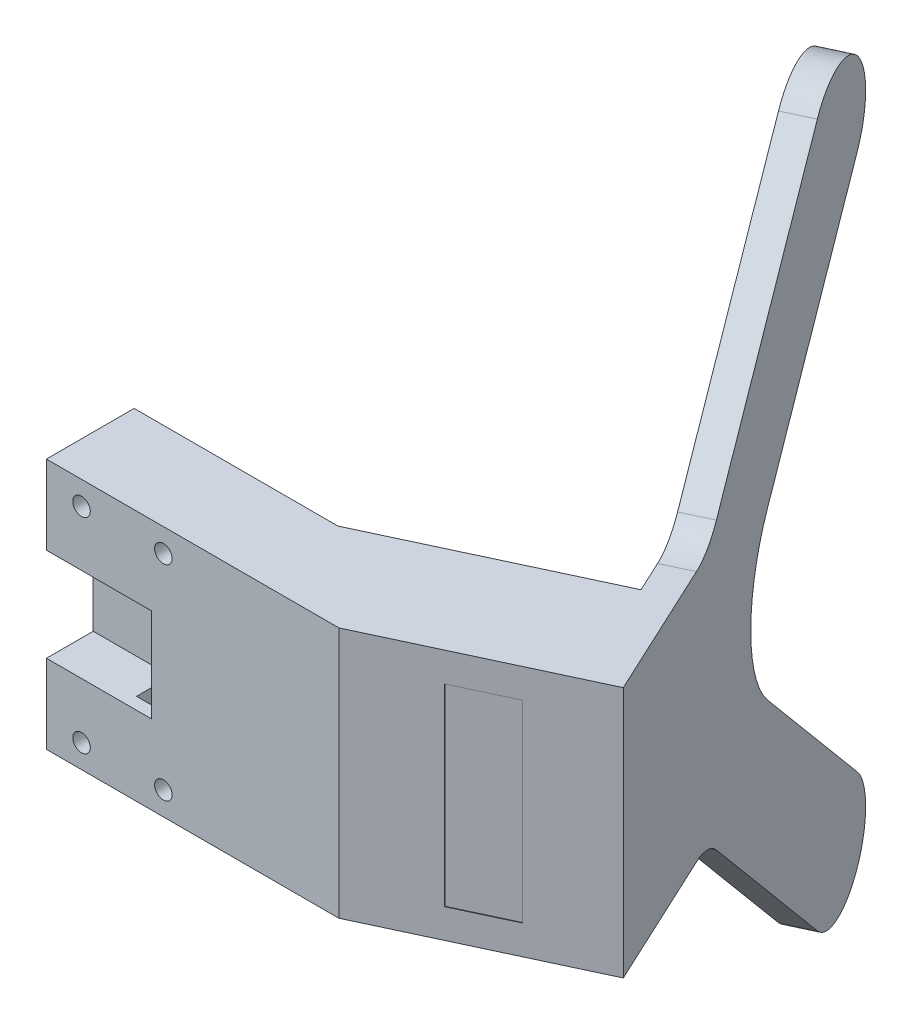
from build123d import *

# Parameters (mm, degrees)
AUFSATZ_LINEAR_AUSTRAGEN1_DEPTH      = 43
AUFSATZ_LINEAR_AUSTRAGEN2_DEPTH      = 5
SCHNITT_LINEAR_AUSTRAGEN1_REACH      = 157.451
SKIZZE3_R                            = 1.5
SKIZZE4_W                            = 8
SKIZZE4_H                            = 16
SCHNITT_LINEAR_AUSTRAGEN2_DEPTH      = 18
SKIZZE5_W                            = 30
SKIZZE5_H                            = 39
SCHNITT_LINEAR_AUSTRAGEN3_DEPTH      = 18
SKIZZE6_W                            = 7
SKIZZE6_H                            = 7.5
SKIZZE6_H_2                          = 14
SKIZZE6_H_3                          = 5.5
AUFSATZ_LINEAR_AUSTRAGEN3_DEPTH      = 4
VERRUNDUNG1_R                        = 2
F_3_4_3_4_DURCHMESSER_BOHRUNG1_D     = 3.4
F_3_4_3_4_DURCHMESSER_BOHRUNG1_DEPTH = 4
SKIZZE10_W                           = 10
SKIZZE10_H                           = 33
SCHNITT_LINEAR_AUSTRAGEN4_DEPTH      = 1
SKIZZE11_W                           = 10
SKIZZE11_H                           = 33
SCHNITT_LINEAR_AUSTRAGEN5_DEPTH      = 0.1
SCHNITT_LINEAR_AUSTRAGEN7_DEPTH      = 39
SKIZZE15_W                           = 10.432594073
SKIZZE15_H                           = 24
SCHNITT_LINEAR_AUSTRAGEN10_DEPTH     = 16
SKIZZE16_W                           = 2.1
SKIZZE16_H                           = 39
SCHNITT_LINEAR_AUSTRAGEN11_DEPTH     = 2
VERRUNDUNG2_R                        = 20
VERRUNDUNG3_R                        = 10
SKIZZE17_W                           = 6
SKIZZE17_H                           = 6
AUFSATZ_LINEAR_AUSTRAGEN4_DEPTH      = 5
FASE1_SIZE                           = 6
F_3_4_3_4_DURCHMESSER_BOHRUNG2_D     = 3.4
F_3_4_3_4_DURCHMESSER_BOHRUNG2_DEPTH = 5
F_3_4_3_4_DURCHMESSER_BOHRUNG2_TIP   = 1.021463052


with BuildPart() as part:
    # Skizze1 → Aufsatz-Linear austragen1 (new body)
    with BuildSketch(Plane(origin=(0, 0, 0), x_dir=(1, 0, 0), z_dir=(0, 1, 0))):
        Polygon((0, 0), (50, 0), (78.641941074, 13.355956467), (70.189575839, 31.482112208), (34.843572145, 15), (0, 15), align=None)
    extrude(amount=AUFSATZ_LINEAR_AUSTRAGEN1_DEPTH)

    # Skizze2 → Aufsatz-Linear austragen2 (add)
    with BuildSketch(Plane(origin=(69.711631316, 0, -32.507067545), x_dir=(-0.4226182617407004, 0, -0.9063077870366495), z_dir=(0.9063077870366495, 0, -0.4226182617407004))):
        Polygon((-21.130913087, 43), (8.869086913, 43), (54.544231126, 88.675144213), (68.686366749, 74.533008589), (15.65335816, 21.5), (68.686366749, -31.533008589), (54.544231126, -45.675144213), (8.869086913, 0), (-21.130913087, 0), align=None)
    extrude(amount=AUFSATZ_LINEAR_AUSTRAGEN2_DEPTH)

    # Skizze3 → Schnitt-Linear austragen1 (cut, up to next)
    with BuildSketch(Plane.XY, mode=Mode.PRIVATE) as schnitt_linear_austragen1_sk1:
        with Locations((6, 39)):
            Circle(SKIZZE3_R)
    schnitt_linear_austragen1_tool1 = extrude(schnitt_linear_austragen1_sk1.sketch, amount=-SCHNITT_LINEAR_AUSTRAGEN1_REACH, mode=Mode.PRIVATE) & part.part
    # Skizze3 → Schnitt-Linear austragen1 (cut, up to next)
    with BuildSketch(Plane.XY, mode=Mode.PRIVATE) as schnitt_linear_austragen1_sk2:
        with Locations((20, 39)):
            Circle(SKIZZE3_R)
    schnitt_linear_austragen1_tool2 = extrude(schnitt_linear_austragen1_sk2.sketch, amount=-SCHNITT_LINEAR_AUSTRAGEN1_REACH, mode=Mode.PRIVATE) & part.part
    # Skizze3 → Schnitt-Linear austragen1 (cut, up to next)
    with BuildSketch(Plane.XY, mode=Mode.PRIVATE) as schnitt_linear_austragen1_sk3:
        with Locations((6, 4)):
            Circle(SKIZZE3_R)
    schnitt_linear_austragen1_tool3 = extrude(schnitt_linear_austragen1_sk3.sketch, amount=-SCHNITT_LINEAR_AUSTRAGEN1_REACH, mode=Mode.PRIVATE) & part.part
    # Skizze3 → Schnitt-Linear austragen1 (cut, up to next)
    with BuildSketch(Plane.XY, mode=Mode.PRIVATE) as schnitt_linear_austragen1_sk4:
        with Locations((20, 4)):
            Circle(SKIZZE3_R)
    schnitt_linear_austragen1_tool4 = extrude(schnitt_linear_austragen1_sk4.sketch, amount=-SCHNITT_LINEAR_AUSTRAGEN1_REACH, mode=Mode.PRIVATE) & part.part
    add(schnitt_linear_austragen1_tool1.solids().sort_by_distance((6, 39, 0))[0], mode=Mode.SUBTRACT)
    add(schnitt_linear_austragen1_tool2.solids().sort_by_distance((20, 39, 0))[0], mode=Mode.SUBTRACT)
    add(schnitt_linear_austragen1_tool3.solids().sort_by_distance((6, 4, 0))[0], mode=Mode.SUBTRACT)
    add(schnitt_linear_austragen1_tool4.solids().sort_by_distance((20, 4, 0))[0], mode=Mode.SUBTRACT)

    # Skizze4 → Schnitt-Linear austragen2 (cut)
    with BuildSketch(Plane.ZY):
        with Locations((-4, 21.5)):
            Rectangle(SKIZZE4_W, SKIZZE4_H)
    extrude(amount=-SCHNITT_LINEAR_AUSTRAGEN2_DEPTH, mode=Mode.SUBTRACT)

    # Skizze5 → Schnitt-Linear austragen3 (cut)
    with BuildSketch(Plane(origin=(0.477944523, 0, 1.024955337), x_dir=(-0.9063077870366492, 0, 0.4226182617407011), z_dir=(-0.4226182617407011, 0, -0.9063077870366492))):
        with Locations((-60.918274689, 21.5)):
            Rectangle(SKIZZE5_W, SKIZZE5_H)
    extrude(amount=-SCHNITT_LINEAR_AUSTRAGEN3_DEPTH, mode=Mode.SUBTRACT)

    # Skizze6 → Aufsatz-Linear austragen3 (add)
    with BuildSketch(Plane(origin=(8.085073234, 0, 17.338495504), x_dir=(-0.9063077870366492, 0, 0.42261826174070133), z_dir=(-0.42261826174070133, 0, -0.9063077870366492))):
        with Locations((-72.418274689, 37.25)):
            Rectangle(SKIZZE6_W, SKIZZE6_H)
        with Locations((-72.418274689, 18.5)):
            Rectangle(SKIZZE6_W, SKIZZE6_H_2)
        with Locations((-72.418274689, 4.75)):
            Rectangle(SKIZZE6_W, SKIZZE6_H_3)
    extrude(amount=AUFSATZ_LINEAR_AUSTRAGEN3_DEPTH)

    # Verrundung1
    verrundung1_edges = [part.edges().sort_by_distance(p)[0] for p in [
        (69.701005731, 33.5, -13.600241521),
        (69.701005731, 11.5, -13.600241521),
        (69.701005731, 25.5, -13.600241521),
        (69.701005731, 7.5, -13.600241521),
    ]]
    fillet(verrundung1_edges, radius=VERRUNDUNG1_R)

    # Ø3.4 (3.4) Durchmesser Bohrung1
    with Locations(Plane(origin=(6.394600187, 0, 13.713264356), x_dir=(-0.906307787036649, 0, 0.4226182617407016), z_dir=(-0.4226182617407016, 0, -0.906307787036649))):
        with Locations((-72.418274689, 37), (-72.418274689, 22), (-71.418274689, 14.1), (-71.418274689, 5)):
            Hole(F_3_4_3_4_DURCHMESSER_BOHRUNG1_D / 2, depth=F_3_4_3_4_DURCHMESSER_BOHRUNG1_DEPTH)

    # Skizze10 → Schnitt-Linear austragen4 (cut)
    with BuildSketch(Plane(origin=(8.085073234, 0, 17.338495504), x_dir=(-0.9063077870366492, 0, 0.42261826174070133), z_dir=(-0.42261826174070133, 0, -0.9063077870366492))):
        with Locations((-63.918274689, 21.5)):
            Rectangle(SKIZZE10_W, SKIZZE10_H)
    extrude(amount=-SCHNITT_LINEAR_AUSTRAGEN4_DEPTH, mode=Mode.SUBTRACT)

    # Skizze11 → Schnitt-Linear austragen5 (cut)
    with BuildSketch(Plane(origin=(8.930309758, 0, 19.151111078), x_dir=(0.9063077870366492, 0, -0.42261826174070133), z_dir=(0.42261826174070133, 0, 0.9063077870366492))):
        with Locations((63.918274689, 21.5)):
            Rectangle(SKIZZE11_W, SKIZZE11_H)
    extrude(amount=-SCHNITT_LINEAR_AUSTRAGEN5_DEPTH, mode=Mode.SUBTRACT)

    # Skizze12 → Schnitt-Linear austragen7 (cut)
    with BuildSketch(Plane(origin=(0, 2, 0), x_dir=(1, 0, 0), z_dir=(0, 1, 0))):
        Polygon((49.701163152, 2.067405927), (42.094034441, 18.380946094), (34.843572145, 15), (34.843572145, 12.5), (29.343572145, 12.5), (29.343572145, 2.067405927), align=None)
    extrude(amount=SCHNITT_LINEAR_AUSTRAGEN7_DEPTH, mode=Mode.SUBTRACT)

    # Skizze15 → Schnitt-Linear austragen10 (cut)
    with BuildSketch(Plane(origin=(29.343572145, 0, 0), x_dir=(0, 0, -1), z_dir=(1, 0, 0))):
        with Locations((7.283702963, 21.5)):
            Rectangle(SKIZZE15_W, SKIZZE15_H)
    extrude(amount=-SCHNITT_LINEAR_AUSTRAGEN10_DEPTH, mode=Mode.SUBTRACT)

    # Skizze16 → Schnitt-Linear austragen11 (cut)
    with BuildSketch(Plane(origin=(68.805323529, 0, -32.084449283), x_dir=(0.42261826174070133, 0, 0.9063077870366492), z_dir=(-0.9063077870366492, 0, 0.42261826174070133))):
        with Locations((2.180913087, 21.5)):
            Rectangle(SKIZZE16_W, SKIZZE16_H)
    extrude(amount=-SCHNITT_LINEAR_AUSTRAGEN11_DEPTH, mode=Mode.SUBTRACT)

    # Verrundung2
    verrundung2_edges = [part.edges().sort_by_distance(p)[0] for p in [
        (65.362005767, 21.5, -47.750373594),
    ]]
    fillet(verrundung2_edges, radius=VERRUNDUNG2_R)

    # Verrundung3
    verrundung3_edges = [part.edges().sort_by_distance(p)[0] for p in [
        (68.229162689, 43, -41.601735733),
        (68.229162689, 0, -41.601735733),
        (42.949287863, 74.533008589, -95.814602248),
        (48.926012637, 88.675144213, -82.997474607),
        (48.926012637, -45.675144213, -82.997474607),
        (42.949287863, -31.533008589, -95.814602248),
    ]]
    fillet(verrundung3_edges, radius=VERRUNDUNG3_R - 0.0001)  # a hair under: the kernel refuses the full size

    # Skizze17 → Aufsatz-Linear austragen4 (add)
    with BuildSketch(Plane(origin=(1.323181047, 0, 2.837570911), x_dir=(-0.9063077870366492, 0, 0.4226182617407011), z_dir=(-0.4226182617407011, 0, -0.9063077870366492))):
        with Locations((-40.918274689, 38)):
            Rectangle(SKIZZE17_W, SKIZZE17_H)
        with Locations((-40.918274689, 5)):
            Rectangle(SKIZZE17_W, SKIZZE17_H)
    extrude(amount=-AUFSATZ_LINEAR_AUSTRAGEN4_DEPTH)

    # Fase1
    fase1_edges = [part.edges().sort_by_distance(p)[0] for p in [
        (40.520823338, 2, -9.923700276),
        (40.520823338, 41, -9.923700276),
    ]]
    chamfer(fase1_edges, length=FASE1_SIZE - 0.0001)  # a hair under: the kernel refuses the full size

    # Ø3.4 (3.4) Durchmesser Bohrung2
    with Locations(Plane(origin=(1.323181047, 0, 2.837570911), x_dir=(-0.9063077870366492, 0, 0.4226182617407014), z_dir=(-0.42261826174070133, 0, -0.906307787036649))):
        with Locations((-40.918274689, 38), (-40.918274689, 5)):
            Hole(F_3_4_3_4_DURCHMESSER_BOHRUNG2_D / 2, depth=F_3_4_3_4_DURCHMESSER_BOHRUNG2_DEPTH)
            with Locations((0, 0, -(F_3_4_3_4_DURCHMESSER_BOHRUNG2_DEPTH + F_3_4_3_4_DURCHMESSER_BOHRUNG2_TIP / 2))):  # 118° drill point
                Cone(0, F_3_4_3_4_DURCHMESSER_BOHRUNG2_D / 2, F_3_4_3_4_DURCHMESSER_BOHRUNG2_TIP, mode=Mode.SUBTRACT)


solid = part.part
